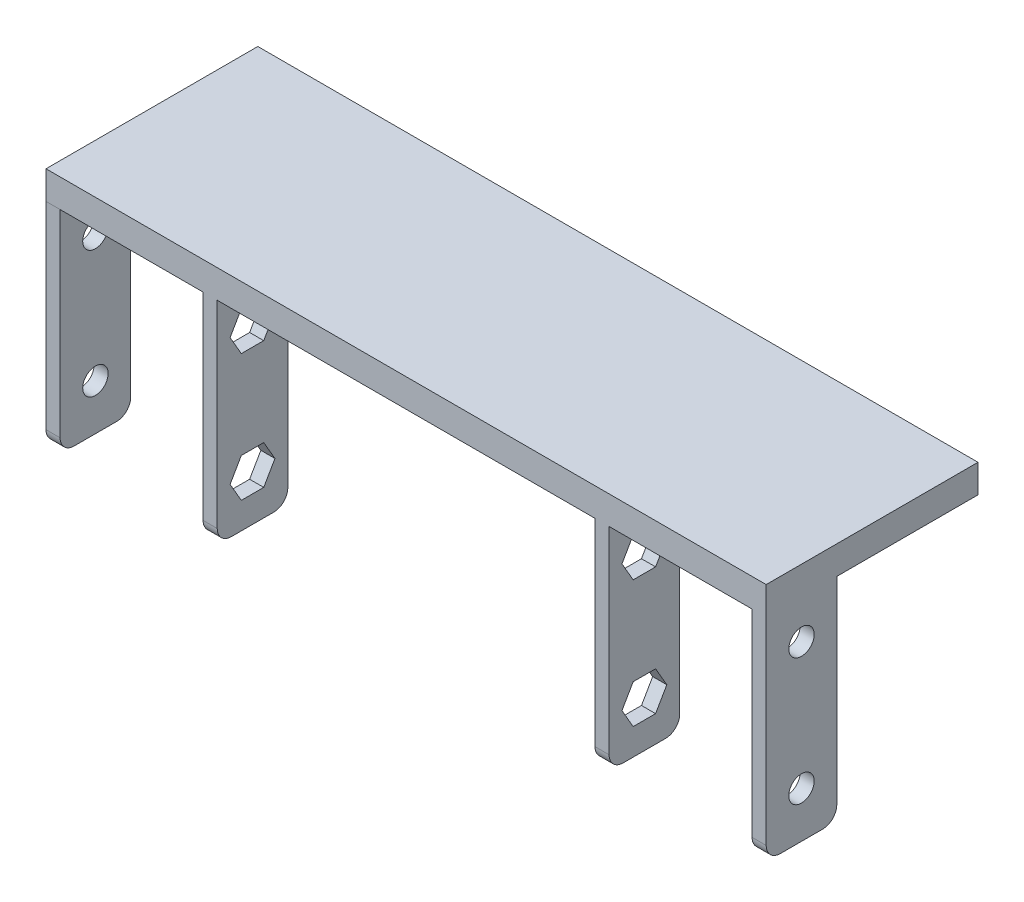
from build123d import *

# Parameters (mm, degrees)
SALIENTE_EXTRUIR1_DEPTH     = 9
CROQUIS1_W                  = 2
CROQUIS1_H                  = 8.9
SALIENTE_EXTRUIR1_2_DEPTH   = 9
SALIENTE_EXTRUIR1_3_DEPTH   = 9
SALIENTE_EXTRUIR1_4_DEPTH   = 9
CROQUIS2_W                  = 2
CROQUIS2_H                  = 0.3
SALIENTE_EXTRUIR3_DEPTH     = 5
SALIENTE_EXTRUIR5_DEPTH     = 8.9
CROQUIS6_R                  = 2
SALIENTE_EXTRUIR6_DEPTH     = 4
SALIENTE_EXTRUIR7_DEPTH     = 7
SALIENTE_EXTRUIR8_DEPTH     = 4
SALIENTE_EXTRUIR9_START     = 13.5
SALIENTE_EXTRUIR9_DEPTH     = 13.5
REDONDEO1_START             = -0.677871649
REDONDEO1_DEPTH             = 24.677871649
SALIENTE_EXTRUIR10_DEPTH    = 4
CORTAR_EXTRUIR1_DEPTH       = 56.136761934
CORTAR_EXTRUIR1_DEPTH_BACK  = 5
CROQUIS12_R                 = 2.75
CORTAR_EXTRUIR2_START       = -4
CROQUIS13_R                 = 2
CORTAR_EXTRUIR2_DEPTH       = 4
REDONDEO4_R                 = 5
CROQUIS15_R                 = 2.5
CORTAR_EXTRUIR4_DEPTH       = 2
CROQUIS16_W                 = 2
CROQUIS16_H                 = 10
SALIENTE_EXTRUIR11_DEPTH    = 30
SALIENTE_EXTRUIR11_2_DEPTH  = 30
SALIENTE_EXTRUIR11_3_DEPTH  = 30
SALIENTE_EXTRUIR11_4_DEPTH  = 30
SALIENTE_EXTRUIR12_DEPTH    = 4
CROQUIS19_R                 = 1.8
CORTAR_EXTRUIR6_DEPTH       = 151.577430248
CORTAR_EXTRUIR7_DEPTH       = 60
CORTAR_EXTRUIR7_DEPTH_BACK  = 10
CORTAR_EXTRUIR12_DEPTH      = 122.944915843
CORTAR_EXTRUIR12_DEPTH_BACK = 122.944915843
CROQUIS24_W                 = 213.992672445
CROQUIS24_H                 = 195.620893339
REDONDEO5_R                 = 2
REDONDEO6_R                 = 2
REDONDEO7_R                 = 2


with BuildPart() as part:
    # Croquis1 → Saliente-Extruir1 (new body)
    with BuildSketch(Plane.XY):
        Polygon((9, 6.75), (-9, 6.75), (-9, 4.75), (-7, 4.75), (7, 4.75), (9, 4.75), align=None)
    extrude(amount=SALIENTE_EXTRUIR1_DEPTH)



with BuildPart() as body_2:
    # Croquis1 → Saliente-Extruir1 2 (new body)
    with BuildSketch(Plane.XY):
        with Locations((-8, 0)):
            Rectangle(CROQUIS1_W, CROQUIS1_H)
    extrude(amount=SALIENTE_EXTRUIR1_2_DEPTH)


with BuildPart() as body_3:
    # Croquis1 → Saliente-Extruir1 3 (new body)
    with BuildSketch(Plane.XY):
        Polygon((-7, -4.75), (-9, -4.75), (-9, -6.75), (9, -6.75), (9, -4.75), (7, -4.75), align=None)
    extrude(amount=SALIENTE_EXTRUIR1_3_DEPTH)


with BuildPart() as body_4:
    # Croquis1 → Saliente-Extruir1 4 (new body)
    with BuildSketch(Plane.XY):
        with Locations((8, 0)):
            Rectangle(CROQUIS1_W, CROQUIS1_H)
    extrude(amount=SALIENTE_EXTRUIR1_4_DEPTH)


with BuildPart() as part_1:
    add(part.part)

    add(body_2.part)  # Saliente-Extruir3 merges body 2

    add(body_3.part)  # Saliente-Extruir3 merges body 3

    add(body_4.part)  # Saliente-Extruir3 merges body 4
    # Croquis2 → Saliente-Extruir3 (add)
    with BuildSketch(Plane.XY):
        with Locations((8, 4.6)):
            Rectangle(CROQUIS2_W, CROQUIS2_H)
        with Locations((8, -4.6)):
            Rectangle(CROQUIS2_W, CROQUIS2_H)
        with Locations((-8, -4.6)):
            Rectangle(CROQUIS2_W, CROQUIS2_H)
        with Locations((-8, 4.6)):
            Rectangle(CROQUIS2_W, CROQUIS2_H)
    extrude(amount=SALIENTE_EXTRUIR3_DEPTH)

    # Croquis5 → Saliente-Extruir5 (add)
    with BuildSketch(Plane(origin=(0, 4.45, 0), x_dir=(1, 0, 0), z_dir=(0, 1, 0))):
        Polygon((6, -9), (7, -9), (7, -7), align=None)
        Polygon((-7, -7), (-7, -9), (-6, -9), align=None)
    extrude(amount=-SALIENTE_EXTRUIR5_DEPTH)

    # Croquis6 → Saliente-Extruir6 (add)
    with BuildSketch(Plane.XZ.offset(6.75)):
        with BuildLine():
            ThreePointArc((-50, 9), (0, -3), (50, 9))
            Line((50, 9), (50, 24))
            ThreePointArc((50, 24), (36.757105541, 16.769444448), (22.5, 11.830808117))
            Line((22.5, 11.830808117), (22.5, 3.422761334))
            ThreePointArc((22.5, 3.422761334), (0, 1.452024157), (-22.5, 3.422761334))
            Line((-22.5, 3.422761334), (-22.5, 11.830808117))
            ThreePointArc((-22.5, 11.830808117), (-36.757105541, 16.769444448), (-50, 24))
            Line((-50, 24), (-50, 9))
        make_face()
        with Locations(Location((46, 16.452024157, 0), (0, 0, 270))):
            Circle(CROQUIS6_R, mode=Mode.SUBTRACT)
        with Locations(Location((-46, 16.452024157, 0), (0, 0, 270))):
            Circle(CROQUIS6_R, mode=Mode.SUBTRACT)
    extrude(amount=SALIENTE_EXTRUIR6_DEPTH)

    # Croquis6<3> → Saliente-Extruir7 (add)
    with BuildSketch(Plane.XZ.offset(6.75)):
        with BuildLine():
            ThreePointArc((-50, 9), (0, -3), (50, 9))
            Line((50, 9), (50, 11.5))
            ThreePointArc((50, 11.5), (36.47427787, 6.697797755), (22.5, 3.422761334))
            ThreePointArc((22.5, 3.422761334), (15.771787387, 2.416580824), (9, 1.765320682))
            Line((9, 1.765320682), (9, 0))
            Line((9, 0), (-9, 0))
            Line((-9, 0), (-9, 1.765320682))
            ThreePointArc((-9, 1.765320682), (-15.771787387, 2.416580824), (-22.5, 3.422761334))
            ThreePointArc((-22.5, 3.422761334), (-36.47427787, 6.697797755), (-50, 11.5))
            Line((-50, 11.5), (-50, 9))
        make_face()
        with BuildLine():
            Line((9, 0), (9, 1.765320682))
            ThreePointArc((9, 1.765320682), (0, 1.452024157), (-9, 1.765320682))
            Line((-9, 1.765320682), (-9, 0))
            Line((-9, 0), (9, 0))
        make_face()
    extrude(amount=SALIENTE_EXTRUIR7_DEPTH)

    # Croquis7 → Saliente-Extruir8 (add)
    with BuildSketch(Plane.XZ.offset(13.75)):
        with BuildLine():
            Line((-22.5, 3.422761334), (-22.5, 11.830808117))
            ThreePointArc((-22.5, 11.830808117), (-36.757105541, 16.769444448), (-50, 24))
            Line((-50, 24), (-50, 11.5))
            Line((-50, 11.5), (-50, 9))
            ThreePointArc((-50, 9), (0, -3), (50, 9))
            Line((50, 9), (50, 11.5))
            Line((50, 11.5), (50, 24))
            ThreePointArc((50, 24), (36.757105541, 16.769444448), (22.5, 11.830808117))
            Line((22.5, 11.830808117), (22.5, 3.422761334))
            ThreePointArc((22.5, 3.422761334), (15.771787387, 2.416580824), (9, 1.765320682))
            ThreePointArc((9, 1.765320682), (0, 1.452024157), (-9, 1.765320682))
            ThreePointArc((-9, 1.765320682), (-15.771787387, 2.416580824), (-22.5, 3.422761334))
        make_face()
    extrude(amount=SALIENTE_EXTRUIR8_DEPTH)

    # Croquis8 → Saliente-Extruir9 (add)
    with BuildSketch(Plane(origin=(0, -6.75, 0), x_dir=(1, 0, 0), z_dir=(0, 1, 0)).offset(SALIENTE_EXTRUIR9_START)):
        with BuildLine():
            Line((-50, -9), (-50, -11.5))
            ThreePointArc((-50, -11.5), (-36.47427787, -6.697797755), (-22.5, -3.422761334))
            Line((-22.5, -3.422761334), (-22.5, 0.677871649))
            ThreePointArc((-22.5, 0.677871649), (-36.571543581, -3.247387202), (-50, -9))
        make_face()
        with BuildLine():
            Line((50, -9), (50, -11.5))
            ThreePointArc((50, -11.5), (36.47427787, -6.697797755), (22.5, -3.422761334))
            Line((22.5, -3.422761334), (22.5, 0.677871649))
            ThreePointArc((22.5, 0.677871649), (36.571543581, -3.247387202), (50, -9))
        make_face()
    extrude(amount=-SALIENTE_EXTRUIR9_DEPTH)

    # Redondeo1: read off the stored shape, not the designer's step
    # Redondeo1 outline → Redondeo1 (cut)
    with BuildSketch(Plane.XY.offset(REDONDEO1_START)):
        with BuildLine():
            ThreePointArc((35, 6.75), (45.606601718, 2.356601718), (50, -8.25))
            Line((50, -8.25), (50, 6.75))
            Line((50, 6.75), (35, 6.75))
        make_face()
        with BuildLine():
            ThreePointArc((-50, -8.25), (-45.606601718, 2.356601718), (-35, 6.75))
            Line((-35, 6.75), (-50, 6.75))
            Line((-50, 6.75), (-50, -8.25))
        make_face()
    extrude(amount=REDONDEO1_DEPTH, mode=Mode.SUBTRACT)

    # Croquis11 → Saliente-Extruir10 (add)
    with BuildSketch(Plane.XZ.offset(6.75)):
        with BuildLine():
            Line((-9, 9), (-9, 1.765320682))
            ThreePointArc((-9, 1.765320682), (0, 1.452024157), (9, 1.765320682))
            Line((9, 1.765320682), (9, 9))
            Line((9, 9), (-9, 9))
        make_face()
    extrude(amount=SALIENTE_EXTRUIR10_DEPTH)

    # Croquis12 → Cortar-Extruir1 (cut, two sides: drawn at the far end of the back side and taken through both)
    with BuildSketch(Plane(origin=(0, 0, 9), x_dir=(-1, 0, 0), z_dir=(0, 0, -1)).offset(-CORTAR_EXTRUIR1_DEPTH_BACK)):
        with Locations(Location((-37, 0, 0), (0, 0, 180))):
            Circle(CROQUIS12_R)
        with Locations(Location((37, 0, 0), (0, 0, 180))):
            Circle(CROQUIS12_R)
    extrude(amount=CORTAR_EXTRUIR1_DEPTH + CORTAR_EXTRUIR1_DEPTH_BACK, mode=Mode.SUBTRACT)

    # Croquis13 → Cortar-Extruir2 (cut)
    with BuildSketch(Plane.XZ.offset(17.75).offset(CORTAR_EXTRUIR2_START)):
        with Locations(Location((46, 16.452024157, 0), (0, 0, 270))):
            Circle(CROQUIS13_R)
        with Locations(Location((-46, 16.452024157, 0), (0, 0, 270))):
            Circle(CROQUIS13_R)
    extrude(amount=CORTAR_EXTRUIR2_DEPTH, mode=Mode.SUBTRACT)

    # Redondeo4
    redondeo4_edges = [part_1.edges().sort_by_distance(p)[0] for p in [
        (-22.5, 6.75, 1.372444842),
        (22.5, 6.75, 1.372444842),
    ]]
    fillet(redondeo4_edges, radius=REDONDEO4_R)

    # Croquis15 → Cortar-Extruir4 (cut)
    with BuildSketch(Plane(origin=(0, -6.75, 0), x_dir=(1, 0, 0), z_dir=(0, 1, 0))):
        with Locations(Location((-46, -16.452024157, 0), (0, 0, 270))):
            Circle(CROQUIS15_R)
        with Locations(Location((46, -16.452024157, 0), (0, 0, 270))):
            Circle(CROQUIS15_R)
    extrude(amount=-CORTAR_EXTRUIR4_DEPTH, mode=Mode.SUBTRACT)

    # Croquis24 → Cortar-Extruir12 (cut, two sides: drawn at the far end of the back side and taken through both)
    with BuildSketch(Plane(origin=(0, 0, 0), x_dir=(0, 0, -1), z_dir=(1, 0, 0)).offset(-CORTAR_EXTRUIR12_DEPTH_BACK)):
        with Locations((-61.147337457, 3.742604374)):
            Rectangle(CROQUIS24_W, CROQUIS24_H)
    extrude(amount=CORTAR_EXTRUIR12_DEPTH + CORTAR_EXTRUIR12_DEPTH_BACK, mode=Mode.SUBTRACT)


with BuildPart() as body_2_2:
    # Croquis16 → Saliente-Extruir11 (new body)
    with BuildSketch(Plane.XZ.offset(10.75)):
        with Locations((27.75, 98)):
            Rectangle(CROQUIS16_W, CROQUIS16_H)
    extrude(amount=SALIENTE_EXTRUIR11_DEPTH)


with BuildPart() as body_3_2:
    # Croquis16 → Saliente-Extruir11 2 (new body)
    with BuildSketch(Plane.XZ.offset(10.75)):
        with Locations((-27.75, 98)):
            Rectangle(CROQUIS16_W, CROQUIS16_H)
    extrude(amount=SALIENTE_EXTRUIR11_2_DEPTH)


    add(body_2_2.part)  # Saliente-Extruir12 merges body 2 2


with BuildPart() as body_4_2:
    # Croquis16 → Saliente-Extruir11 3 (new body)
    with BuildSketch(Plane.XZ.offset(10.75)):
        with Locations((50, 98)):
            Rectangle(CROQUIS16_W, CROQUIS16_H)
    extrude(amount=SALIENTE_EXTRUIR11_3_DEPTH)


with BuildPart() as body_5:
    # Croquis16 → Saliente-Extruir11 4 (new body)
    with BuildSketch(Plane.XZ.offset(10.75)):
        with Locations((-50, 98)):
            Rectangle(CROQUIS16_W, CROQUIS16_H)
    extrude(amount=SALIENTE_EXTRUIR11_4_DEPTH)


with BuildPart() as body_3_2_1:
    add(body_3_2.part)

    add(body_4_2.part)  # Saliente-Extruir12 merges body 4 2
    # Croquis17 → Saliente-Extruir12 (add)
    with BuildSketch(Plane(origin=(0, -10.75, 0), x_dir=(1, 0, 0), z_dir=(0, 1, 0))):
        Polygon((51, -73), (-51, -73), (-51, -103), (-26.75, -103), (26.75, -103), (51, -103), align=None)
    extrude(amount=SALIENTE_EXTRUIR12_DEPTH)


with BuildPart() as cortar_extruir6_tool:
    # Croquis19 → Cortar-Extruir6 (new, through all)
    with BuildSketch(Plane.ZY.offset(51)):
        with Locations((98, -16.25)):
            Circle(CROQUIS19_R)
        with Locations((98, -34.25)):
            Circle(CROQUIS19_R)
    extrude(amount=-CORTAR_EXTRUIR6_DEPTH)


with BuildPart() as body_3_2_2:
    add(body_3_2_1.part)

    # Cortar-Extruir6: cut by cortar_extruir6_tool
    add(cortar_extruir6_tool.part, mode=Mode.SUBTRACT)

    # Croquis20 → Cortar-Extruir7 (cut, two sides: drawn at the far end of the back side and taken through both)
    with BuildSketch(Plane(origin=(-26.75, 0, 0), x_dir=(0, 0, -1), z_dir=(1, 0, 0)).offset(-CORTAR_EXTRUIR7_DEPTH_BACK)):
        Polygon((-99.58771324, -31.5), (-101.175426481, -34.25), (-99.58771324, -37), (-96.41228676, -37), (-94.824573519, -34.25), (-96.41228676, -31.5), align=None)
        Polygon((-99.58771324, -19), (-96.41228676, -19), (-94.824573519, -16.25), (-96.41228676, -13.5), (-99.58771324, -13.5), (-101.175426481, -16.25), align=None)
    extrude(amount=CORTAR_EXTRUIR7_DEPTH + CORTAR_EXTRUIR7_DEPTH_BACK, mode=Mode.SUBTRACT)

    # Redondeo5
    redondeo5_edges = [body_3_2_2.edges().sort_by_distance(p)[0] for p in [
        (27.75, -40.75, 93),
        (27.75, -40.75, 103),
        (50, -40.75, 93),
        (50, -40.75, 103),
    ]]
    fillet(redondeo5_edges, radius=REDONDEO5_R)

    # Redondeo6
    redondeo6_edges = [body_3_2_2.edges().sort_by_distance(p)[0] for p in [
        (-27.75, -40.75, 93),
        (-27.75, -40.75, 103),
    ]]
    fillet(redondeo6_edges, radius=REDONDEO6_R)


with BuildPart() as body_5_1:
    add(body_5.part)

    # Cortar-Extruir6: cut by cortar_extruir6_tool
    add(cortar_extruir6_tool.part, mode=Mode.SUBTRACT)

    # Redondeo7
    redondeo7_edges = [body_5_1.edges().sort_by_distance(p)[0] for p in [
        (-50, -40.75, 93),
        (-50, -40.75, 103),
    ]]
    fillet(redondeo7_edges, radius=REDONDEO7_R)


solid = Compound([body_3_2_2.part, body_5_1.part])
